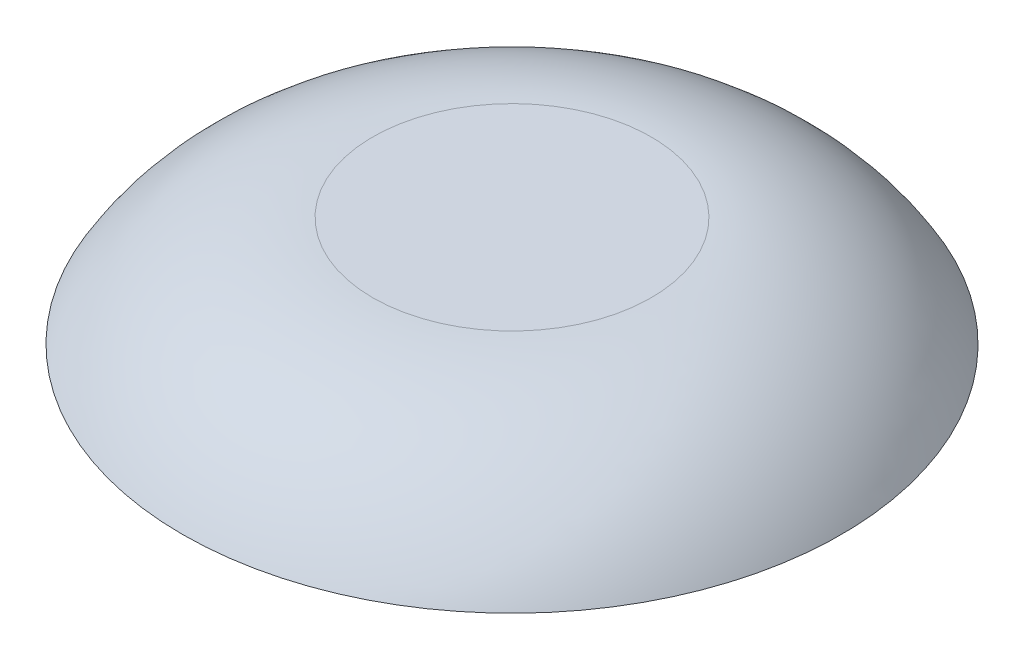
from build123d import *

# Parameters (mm, degrees)
SKETCH1_R           = 15
BOSS_EXTRUDE1_DEPTH = 5
FILLET1_R           = 10


with BuildPart() as part:
    # Sketch1 → Boss-Extrude1 (new body)
    with BuildSketch(Plane(origin=(0, 0, 0), x_dir=(1, 0, 0), z_dir=(0, 1, 0))):
        with Locations(Location((0, 0, 0), (0, 0, 270))):
            Circle(SKETCH1_R)
    extrude(amount=BOSS_EXTRUDE1_DEPTH)

    # Fillet1
    # the kernel refuses this fillet: 10 mm, written as the material it takes off along each edge
    with BuildSketch(Plane(origin=(0, 5, 0), x_dir=(0, 0, 1), z_dir=(-1, 0, 0))) as fillet1_piece_1:
        with BuildLine():
            CenterArc((6.339745962, -10), FILLET1_R, 30, 60)
            Line((6.339745962, 0), (6.339745962, 0.2))
            Line((6.339745962, 0.2), (15, 0.2))
            Line((15, 0.2), (15.2, 0))
            ThreePointArc((15.2, 0), (15.2, -2.5), (15.173205081, -4.9))
            Line((15.173205081, -4.9), (15, -5))
        make_face()
    revolve(axis=Axis((0, 5, 0), (0, 1, 0)), mode=Mode.SUBTRACT)


solid = part.part
